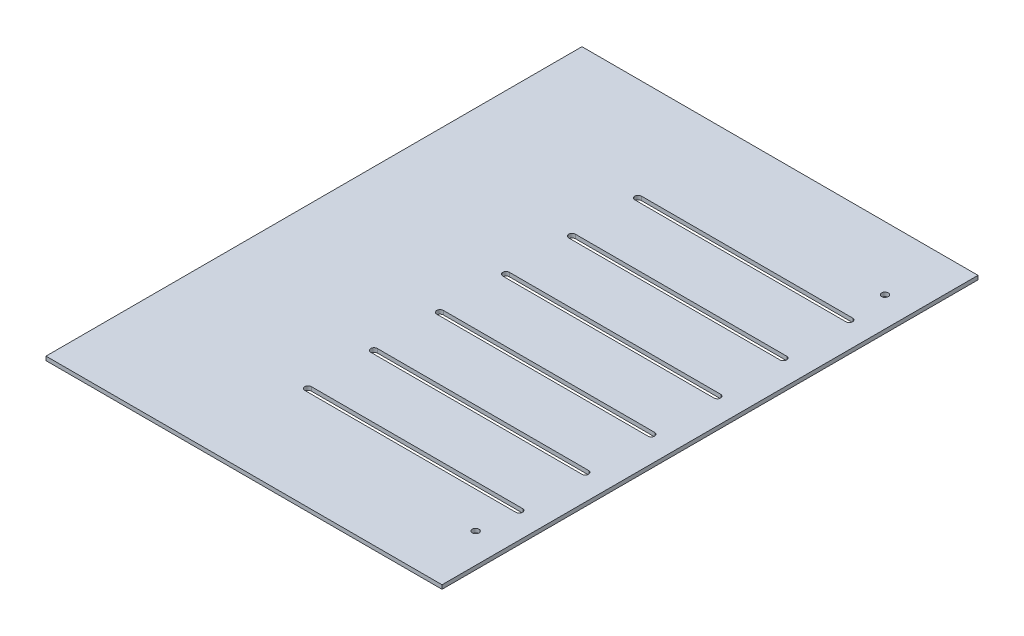
from build123d import *

# Parameters (mm, degrees)
SKETCH1_W           = 300
SKETCH1_H           = 406
BOSS_EXTRUDE1_DEPTH = 3
CUT_EXTRUDE1_REACH  = 254.424
SKETCH2_R           = 2.5
SKETCH3_R           = 2.5
CUT_EXTRUDE2_DEPTH  = 253.424246062
CUT_EXTRUDE3_DEPTH  = 253.424246062


with BuildPart() as part:
    # Sketch1 → Boss-Extrude1 (new body)
    with BuildSketch(Plane(origin=(0, 0, 0), x_dir=(1, 0, 0), z_dir=(0, 1, 0))):
        Rectangle(SKETCH1_W, SKETCH1_H)
    extrude(amount=BOSS_EXTRUDE1_DEPTH)

    # Sketch2 → Cut-Extrude1 (cut, up to next)
    with BuildSketch(Plane(origin=(0, 3, 0), x_dir=(1, 0, 0), z_dir=(0, 1, 0)), mode=Mode.PRIVATE) as cut_extrude1_sk1:
        with Locations((115, 125)):
            Circle(SKETCH2_R)
    cut_extrude1_tool1 = extrude(cut_extrude1_sk1.sketch, amount=-CUT_EXTRUDE1_REACH, mode=Mode.PRIVATE) & part.part
    # Sketch2 → Cut-Extrude1 (cut, up to next)
    with BuildSketch(Plane(origin=(0, 3, 0), x_dir=(1, 0, 0), z_dir=(0, 1, 0)), mode=Mode.PRIVATE) as cut_extrude1_sk2:
        with Locations((115, 75)):
            Circle(SKETCH2_R)
    cut_extrude1_tool2 = extrude(cut_extrude1_sk2.sketch, amount=-CUT_EXTRUDE1_REACH, mode=Mode.PRIVATE) & part.part
    # Sketch2 → Cut-Extrude1 (cut, up to next)
    with BuildSketch(Plane(origin=(0, 3, 0), x_dir=(1, 0, 0), z_dir=(0, 1, 0)), mode=Mode.PRIVATE) as cut_extrude1_sk3:
        with Locations((115, 25)):
            Circle(SKETCH2_R)
    cut_extrude1_tool3 = extrude(cut_extrude1_sk3.sketch, amount=-CUT_EXTRUDE1_REACH, mode=Mode.PRIVATE) & part.part
    # Sketch2 → Cut-Extrude1 (cut, up to next)
    with BuildSketch(Plane(origin=(0, 3, 0), x_dir=(1, 0, 0), z_dir=(0, 1, 0)), mode=Mode.PRIVATE) as cut_extrude1_sk4:
        with Locations((115, -25)):
            Circle(SKETCH2_R)
    cut_extrude1_tool4 = extrude(cut_extrude1_sk4.sketch, amount=-CUT_EXTRUDE1_REACH, mode=Mode.PRIVATE) & part.part
    # Sketch2 → Cut-Extrude1 (cut, up to next)
    with BuildSketch(Plane(origin=(0, 3, 0), x_dir=(1, 0, 0), z_dir=(0, 1, 0)), mode=Mode.PRIVATE) as cut_extrude1_sk5:
        with Locations((115, -75)):
            Circle(SKETCH2_R)
    cut_extrude1_tool5 = extrude(cut_extrude1_sk5.sketch, amount=-CUT_EXTRUDE1_REACH, mode=Mode.PRIVATE) & part.part
    # Sketch2 → Cut-Extrude1 (cut, up to next)
    with BuildSketch(Plane(origin=(0, 3, 0), x_dir=(1, 0, 0), z_dir=(0, 1, 0)), mode=Mode.PRIVATE) as cut_extrude1_sk6:
        with Locations((115, -125)):
            Circle(SKETCH2_R)
    cut_extrude1_tool6 = extrude(cut_extrude1_sk6.sketch, amount=-CUT_EXTRUDE1_REACH, mode=Mode.PRIVATE) & part.part
    # Sketch2 → Cut-Extrude1 (cut, up to next)
    with BuildSketch(Plane(origin=(0, 3, 0), x_dir=(1, 0, 0), z_dir=(0, 1, 0)), mode=Mode.PRIVATE) as cut_extrude1_sk7:
        with Locations((-14, 125)):
            Circle(SKETCH2_R)
    cut_extrude1_tool7 = extrude(cut_extrude1_sk7.sketch, amount=-CUT_EXTRUDE1_REACH, mode=Mode.PRIVATE) & part.part
    # Sketch2 → Cut-Extrude1 (cut, up to next)
    with BuildSketch(Plane(origin=(0, 3, 0), x_dir=(1, 0, 0), z_dir=(0, 1, 0)), mode=Mode.PRIVATE) as cut_extrude1_sk8:
        with Locations((-14, 75)):
            Circle(SKETCH2_R)
    cut_extrude1_tool8 = extrude(cut_extrude1_sk8.sketch, amount=-CUT_EXTRUDE1_REACH, mode=Mode.PRIVATE) & part.part
    # Sketch2 → Cut-Extrude1 (cut, up to next)
    with BuildSketch(Plane(origin=(0, 3, 0), x_dir=(1, 0, 0), z_dir=(0, 1, 0)), mode=Mode.PRIVATE) as cut_extrude1_sk9:
        with Locations((-14, 25)):
            Circle(SKETCH2_R)
    cut_extrude1_tool9 = extrude(cut_extrude1_sk9.sketch, amount=-CUT_EXTRUDE1_REACH, mode=Mode.PRIVATE) & part.part
    # Sketch2 → Cut-Extrude1 (cut, up to next)
    with BuildSketch(Plane(origin=(0, 3, 0), x_dir=(1, 0, 0), z_dir=(0, 1, 0)), mode=Mode.PRIVATE) as cut_extrude1_sk10:
        with Locations((-14, -25)):
            Circle(SKETCH2_R)
    cut_extrude1_tool10 = extrude(cut_extrude1_sk10.sketch, amount=-CUT_EXTRUDE1_REACH, mode=Mode.PRIVATE) & part.part
    # Sketch2 → Cut-Extrude1 (cut, up to next)
    with BuildSketch(Plane(origin=(0, 3, 0), x_dir=(1, 0, 0), z_dir=(0, 1, 0)), mode=Mode.PRIVATE) as cut_extrude1_sk11:
        with Locations((-14, -75)):
            Circle(SKETCH2_R)
    cut_extrude1_tool11 = extrude(cut_extrude1_sk11.sketch, amount=-CUT_EXTRUDE1_REACH, mode=Mode.PRIVATE) & part.part
    # Sketch2 → Cut-Extrude1 (cut, up to next)
    with BuildSketch(Plane(origin=(0, 3, 0), x_dir=(1, 0, 0), z_dir=(0, 1, 0)), mode=Mode.PRIVATE) as cut_extrude1_sk12:
        with Locations((-14, -125)):
            Circle(SKETCH2_R)
    cut_extrude1_tool12 = extrude(cut_extrude1_sk12.sketch, amount=-CUT_EXTRUDE1_REACH, mode=Mode.PRIVATE) & part.part
    add(cut_extrude1_tool1.solids().sort_by_distance((115, 3, -125))[0], mode=Mode.SUBTRACT)
    add(cut_extrude1_tool2.solids().sort_by_distance((115, 3, -75))[0], mode=Mode.SUBTRACT)
    add(cut_extrude1_tool3.solids().sort_by_distance((115, 3, -25))[0], mode=Mode.SUBTRACT)
    add(cut_extrude1_tool4.solids().sort_by_distance((115, 3, 25))[0], mode=Mode.SUBTRACT)
    add(cut_extrude1_tool5.solids().sort_by_distance((115, 3, 75))[0], mode=Mode.SUBTRACT)
    add(cut_extrude1_tool6.solids().sort_by_distance((115, 3, 125))[0], mode=Mode.SUBTRACT)
    add(cut_extrude1_tool7.solids().sort_by_distance((-14, 3, -125))[0], mode=Mode.SUBTRACT)
    add(cut_extrude1_tool8.solids().sort_by_distance((-14, 3, -75))[0], mode=Mode.SUBTRACT)
    add(cut_extrude1_tool9.solids().sort_by_distance((-14, 3, -25))[0], mode=Mode.SUBTRACT)
    add(cut_extrude1_tool10.solids().sort_by_distance((-14, 3, 25))[0], mode=Mode.SUBTRACT)
    add(cut_extrude1_tool11.solids().sort_by_distance((-14, 3, 75))[0], mode=Mode.SUBTRACT)
    add(cut_extrude1_tool12.solids().sort_by_distance((-14, 3, 125))[0], mode=Mode.SUBTRACT)

    # Sketch3 → Cut-Extrude2 (cut, through all)
    with BuildSketch(Plane(origin=(0, 3, 0), x_dir=(1, 0, 0), z_dir=(0, 1, 0))):
        with Locations((127.5, -155)):
            Circle(SKETCH3_R)
        with Locations((127.5, 155)):
            Circle(SKETCH3_R)
    extrude(amount=-CUT_EXTRUDE2_DEPTH, mode=Mode.SUBTRACT)

    # Sketch4 → Cut-Extrude3 (cut, through all)
    with BuildSketch(Plane(origin=(0, 3, 0), x_dir=(1, 0, 0), z_dir=(0, 1, 0))):
        with BuildLine():
            Line((130.5, -27.5), (-29.5, -27.5))
            ThreePointArc((-29.5, -27.5), (-32, -25), (-29.5, -22.5))
            Line((-29.5, -22.5), (130.5, -22.5))
            ThreePointArc((130.5, -22.5), (133, -25), (130.5, -27.5))
        make_face()
        with BuildLine():
            Line((130.5, -77.5), (-29.5, -77.5))
            ThreePointArc((-29.5, -77.5), (-32, -75), (-29.5, -72.5))
            Line((-29.5, -72.5), (130.5, -72.5))
            ThreePointArc((130.5, -72.5), (133, -75), (130.5, -77.5))
        make_face()
        with BuildLine():
            Line((130.5, -127.5), (-29.5, -127.5))
            ThreePointArc((-29.5, -127.5), (-32, -125), (-29.5, -122.5))
            Line((-29.5, -122.5), (130.5, -122.5))
            ThreePointArc((130.5, -122.5), (133, -125), (130.5, -127.5))
        make_face()
        with BuildLine():
            Line((130.5, 27.5), (-29.5, 27.5))
            ThreePointArc((-29.5, 27.5), (-32, 25), (-29.5, 22.5))
            Line((-29.5, 22.5), (130.5, 22.5))
            ThreePointArc((130.5, 22.5), (133, 25), (130.5, 27.5))
        make_face()
        with BuildLine():
            Line((130.5, 77.5), (-29.5, 77.5))
            ThreePointArc((-29.5, 77.5), (-32, 75), (-29.5, 72.5))
            Line((-29.5, 72.5), (130.5, 72.5))
            ThreePointArc((130.5, 72.5), (133, 75), (130.5, 77.5))
        make_face()
        with BuildLine():
            Line((130.5, 127.5), (-29.5, 127.5))
            ThreePointArc((-29.5, 127.5), (-32, 125), (-29.5, 122.5))
            Line((-29.5, 122.5), (130.5, 122.5))
            ThreePointArc((130.5, 122.5), (133, 125), (130.5, 127.5))
        make_face()
    extrude(amount=-CUT_EXTRUDE3_DEPTH, mode=Mode.SUBTRACT)


solid = part.part
